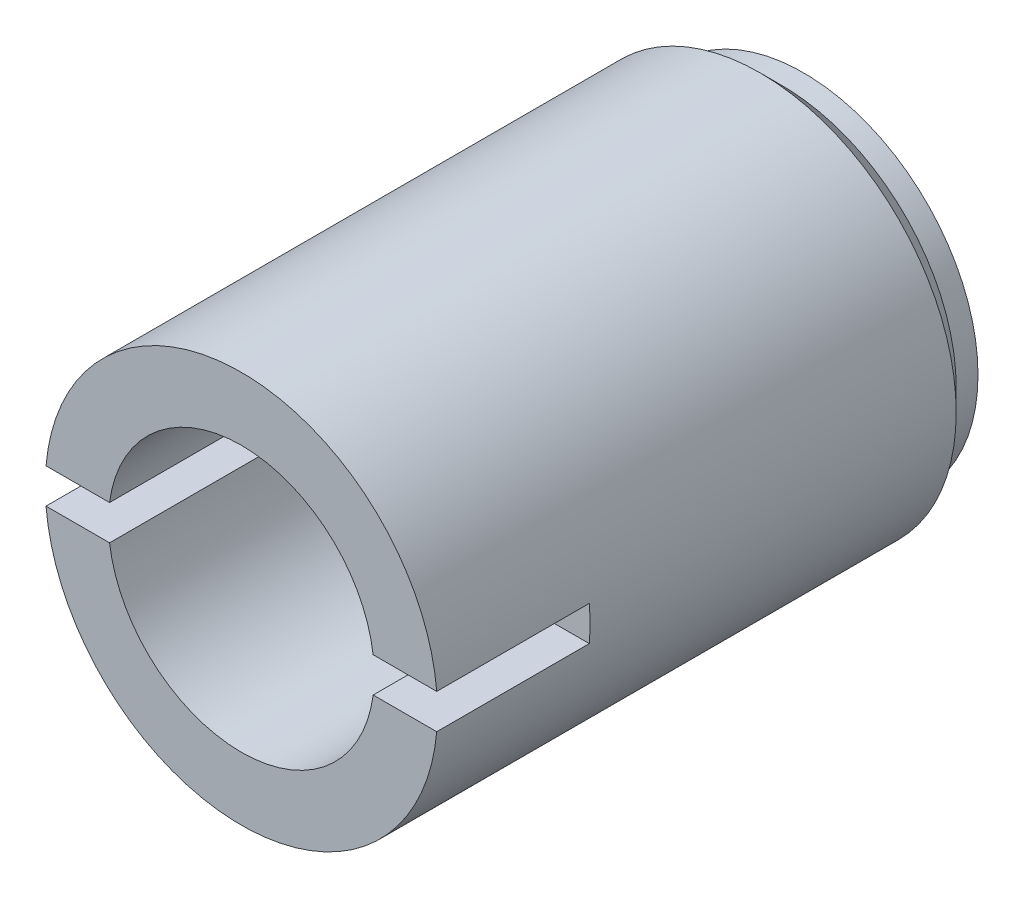
from build123d import *

# Parameters (mm, degrees)
SKETCH1_R                 = 2.75
SKETCH1_R_2               = 1.6
BOSS_EXTRUDE1_DEPTH       = 0.5
SKETCH2_R                 = 4.5
SKETCH2_R_2               = 1.6
BOSS_EXTRUDE2_DEPTH       = 7.4
CHAMFER1_SIZE             = 0.5
SKETCH3_R                 = 4.5
SKETCH3_R_2               = 2.5
BOSS_EXTRUDE3_DEPTH       = 2.2
SKETCH4_R                 = 4.5
SKETCH4_R_2               = 3.05
BOSS_EXTRUDE4_DEPTH       = 2.8
SKETCH5_W                 = 0.8
SKETCH5_H                 = 3.5
CUT_EXTRUDE1_DEPTH        = 4.5
BOSS_EXTRUDE6_START       = -0.5
BOSS_EXTRUDE6_OUTLINE_R   = 4
BOSS_EXTRUDE6_OUTLINE_R_2 = 2.75
BOSS_EXTRUDE6_DEPTH       = 0.5
CUT_EXTRUDE2_START        = -2.2
SKETCH7_R                 = 3.05
CUT_EXTRUDE2_DEPTH        = 2.2


# Read off the part's stored shape, not the designer's step: Boss-Extrude6
with BuildPart() as part:
    # Sketch1 → Boss-Extrude1 (new body)
    with BuildSketch(Plane(origin=(0, 0, 0), x_dir=(0, 1, 0), z_dir=(0, 0, 1))):
        with Locations(Location((0, 0, 0), (0, 0, 270))):
            Circle(SKETCH1_R)
        with Locations(Location((0, 0, 0), (0, 0, 270))):
            Circle(SKETCH1_R_2, mode=Mode.SUBTRACT)
    extrude(amount=BOSS_EXTRUDE1_DEPTH)

    # Sketch2 → Boss-Extrude2 (add)
    with BuildSketch(Plane.XY.offset(0.5)):
        Circle(SKETCH2_R)
        Circle(SKETCH2_R_2, mode=Mode.SUBTRACT)
    extrude(amount=BOSS_EXTRUDE2_DEPTH)

    # Chamfer1
    chamfer1_edges = [part.edges().sort_by_distance(p)[0] for p in [
        (-4.5, 0, 0.5),
    ]]
    chamfer(chamfer1_edges, length=CHAMFER1_SIZE)

    # Sketch3 → Boss-Extrude3 (add)
    with BuildSketch(Plane.XY.offset(7.9)):
        Circle(SKETCH3_R)
        Circle(SKETCH3_R_2, mode=Mode.SUBTRACT)
    extrude(amount=BOSS_EXTRUDE3_DEPTH)

    # Sketch4 → Boss-Extrude4 (add)
    with BuildSketch(Plane.XY.offset(10.1)):
        Circle(SKETCH4_R)
        Circle(SKETCH4_R_2, mode=Mode.SUBTRACT)
    extrude(amount=BOSS_EXTRUDE4_DEPTH)

    # Sketch5 → Cut-Extrude1 (cut, symmetric)
    with BuildSketch(Plane.YZ):
        with Locations((0, 11.15)):
            Rectangle(SKETCH5_W, SKETCH5_H)
    extrude(amount=CUT_EXTRUDE1_DEPTH, both=True, mode=Mode.SUBTRACT)

    # Boss-Extrude6 outline → Boss-Extrude6 (add)
    with BuildSketch(Plane(origin=(0, 0, 0), x_dir=(1, 0, 0), z_dir=(0, 0, -1)).offset(BOSS_EXTRUDE6_START)):
        Circle(BOSS_EXTRUDE6_OUTLINE_R)
        Circle(BOSS_EXTRUDE6_OUTLINE_R_2, mode=Mode.SUBTRACT)
    extrude(amount=BOSS_EXTRUDE6_DEPTH)

    # Sketch7 → Cut-Extrude2 (cut)
    with BuildSketch(Plane.XY.offset(10.1).offset(CUT_EXTRUDE2_START)):
        with Locations(Location((0, 0, 0), (0, 0, 187.535909342))):
            Circle(SKETCH7_R)
    extrude(amount=CUT_EXTRUDE2_DEPTH, mode=Mode.SUBTRACT)


solid = part.part
